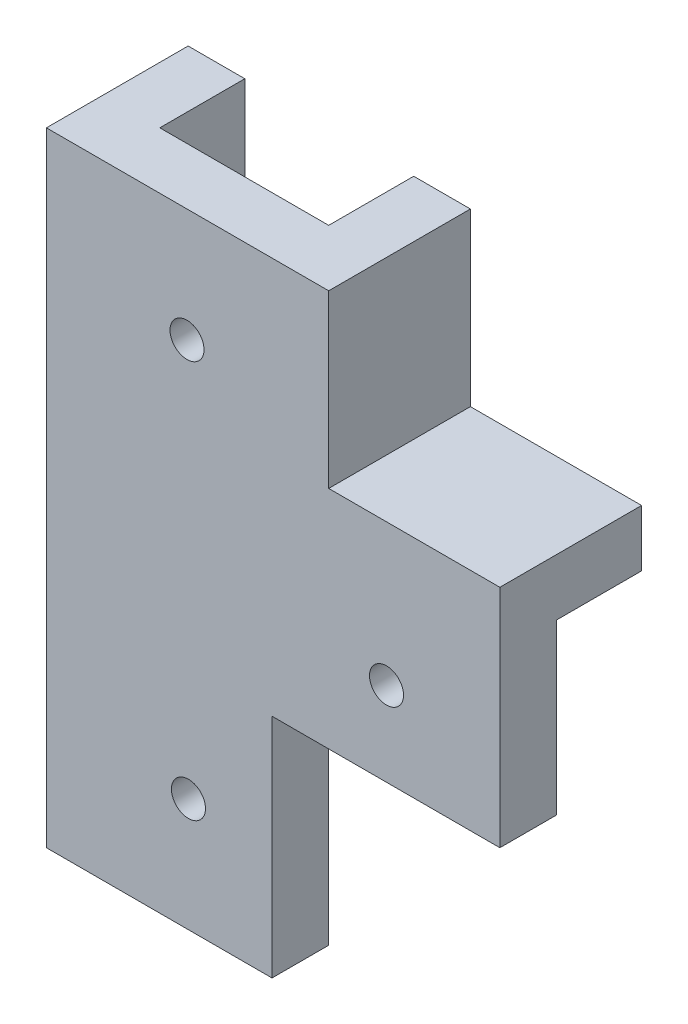
from build123d import *

# Parameters (mm, degrees)
BOSS_EXTRUDE1_DEPTH = 5
BOSS_EXTRUDE2_DEPTH = 7.5
BOSS_EXTRUDE3_DEPTH = 7.5
SKETCH4_R           = 1.5
CUT_EXTRUDE1_DEPTH  = 54.936239309
SKETCH6_W           = 14.9
SKETCH6_H           = 20
BOSS_EXTRUDE4_DEPTH = 5
SKETCH8_R           = 1.5
CUT_EXTRUDE3_DEPTH  = 55.85542736
SKETCH9_W           = 5
SKETCH9_H           = 55
BOSS_EXTRUDE5_DEPTH = 5
BOSS_EXTRUDE6_DEPTH = 5


with BuildPart() as part:
    # Sketch1 → Boss-Extrude1 (new body)
    with BuildSketch(Plane.XY):
        Polygon((7.370119522, -25.806772908), (27.470119522, -25.806772908), (27.470119522, -10.906772908), (7.370119522, -10.906772908), (7.370119522, 9.193227092), (-7.529880478, 9.193227092), (-7.529880478, -25.806772908), align=None)
    extrude(amount=BOSS_EXTRUDE1_DEPTH)

    # Sketch4 → Cut-Extrude1 (cut, through all)
    with BuildSketch(Plane(origin=(0, 0, 0), x_dir=(-1, 0, 0), z_dir=(0, 0, -1))):
        with Locations((0.129880478, -0.806772908)):
            Circle(SKETCH4_R)
        with Locations((-17.470119522, -18.406772908)):
            Circle(SKETCH4_R)
    extrude(amount=-CUT_EXTRUDE1_DEPTH, mode=Mode.SUBTRACT)

    # Sketch6 → Boss-Extrude4 (add)
    with BuildSketch(Plane.XY.offset(5)):
        with Locations((-0.079880478, -35.806772908)):
            Rectangle(SKETCH6_W, SKETCH6_H)
    extrude(amount=-BOSS_EXTRUDE4_DEPTH)

    # Sketch8 → Cut-Extrude3 (cut, through all)
    with BuildSketch(Plane.XY.offset(5)):
        with Locations((0, -35.806772908)):
            Circle(SKETCH8_R)
    extrude(amount=-CUT_EXTRUDE3_DEPTH, mode=Mode.SUBTRACT)



with BuildPart() as body_2:
    # Sketch2 → Boss-Extrude2 (new body)
    with BuildSketch(Plane(origin=(0, 0, 0), x_dir=(-1, 0, 0), z_dir=(0, 0, -1))):
        Polygon((-7.370119522, 9.193227092), (-12.370119522, 9.193227092), (-12.370119522, -5.906772908), (-27.470119522, -5.906772908), (-27.470119522, -10.906772908), (-7.370119522, -10.906772908), align=None)
    extrude(amount=BOSS_EXTRUDE2_DEPTH)


with BuildPart() as body_3:
    # Sketch3 → Boss-Extrude3 (new body)
    with BuildSketch(Plane(origin=(0, 0, 0), x_dir=(-1, 0, 0), z_dir=(0, 0, -1))):
        Polygon((7.529880478, 9.193227092), (12.529880478, 9.193227092), (12.529880478, -45.806772908), (7.529880478, -45.806772908), (7.529880478, -25.806772908), align=None)
    extrude(amount=BOSS_EXTRUDE3_DEPTH)


with BuildPart() as part_1:
    add(part.part)

    add(body_3.part)  # Boss-Extrude5 merges body 3
    # Sketch9 → Boss-Extrude5 (add)
    with BuildSketch(Plane.XY.offset(5)):
        with Locations((-10.029880478, -18.306772908)):
            Rectangle(SKETCH9_W, SKETCH9_H)
    extrude(amount=-BOSS_EXTRUDE5_DEPTH)


    add(body_2.part)  # Boss-Extrude6 merges body 2
    # Sketch10 → Boss-Extrude6 (add)
    with BuildSketch(Plane.XY):
        Polygon((7.370119522, 9.193227092), (12.370119522, 9.193227092), (12.370119522, -5.906772908), (27.470119522, -5.906772908), (27.470119522, -10.906772908), (7.370119522, -10.906772908), align=None)
    extrude(amount=BOSS_EXTRUDE6_DEPTH)


solid = part_1.part
